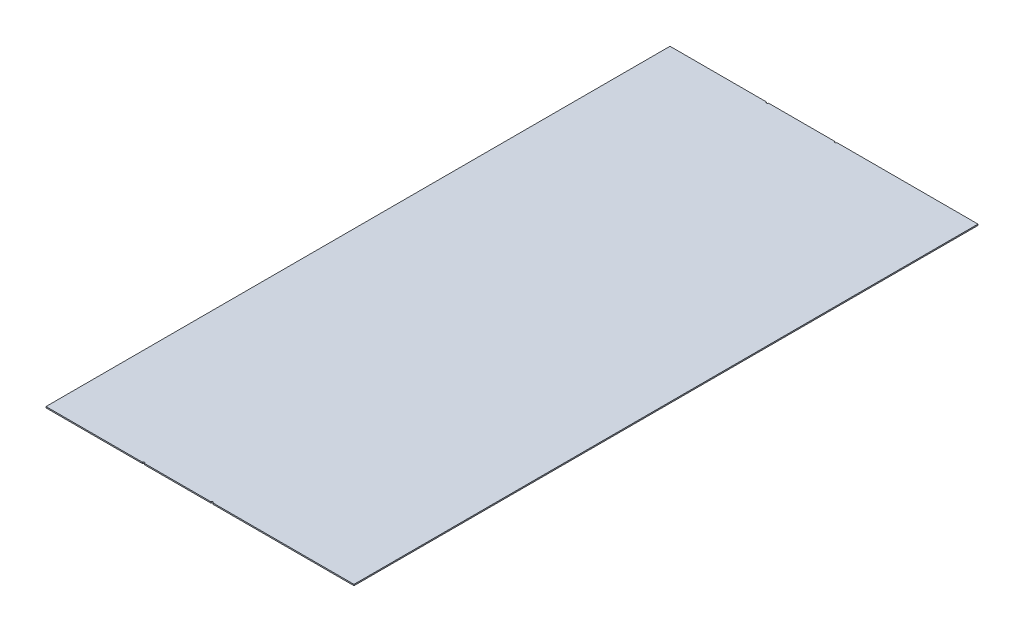
from build123d import *

# Parameters (mm, degrees)
TABAN_FLAN_1_DEPTH        = 2550
KES_EKSTR_ZYON1_OUTLINE_W = 207
KES_EKSTR_ZYON1_OUTLINE_H = 2550
KES_EKSTR_ZYON1_DEPTH     = 595
KES_EKSTR_ZYON1_START     = -5
KES_EKSTR_ZYON1_2_DEPTH   = 5
KES_EKSTR_ZYON1_3_DEPTH   = 5


# Read off the part's stored shape, not the designer's step: Kes-Ekstrüzyon1
# Sheet-metal steps are written as plain solids
with BuildPart() as part:
    # Çizim1 → Taban-Flanş1 (new body)
    with BuildSketch(Plane.XY):
        with BuildLine():
            Line((0, 0), (0, -395.857864376))
            ThreePointArc((0, -395.857864376), (0.761204675, -399.6846987), (2.928932188, -402.928932188))
            Line((2.928932188, -402.928932188), (197.071067812, -597.071067812))
            ThreePointArc((197.071067812, -597.071067812), (200.3153013, -599.238795325), (204.142135624, -600))
            Line((204.142135624, -600), (782.34, -600))
            Line((782.34, -600), (782.34, -595))
            Line((782.34, -595), (204.142135624, -595))
            ThreePointArc((204.142135624, -595), (202.228718462, -594.619397663), (200.606601718, -593.535533906))
            Line((200.606601718, -593.535533906), (6.464466094, -399.393398282))
            ThreePointArc((6.464466094, -399.393398282), (5.380602337, -397.771281538), (5, -395.857864376))
            Line((5, -395.857864376), (5, 0))
            Line((5, 0), (0, 0))
        make_face()
    extrude(amount=-TABAN_FLAN_1_DEPTH)

    # Kes-Ekstrüzyon1 outline → Kes-Ekstrüzyon1 (cut)
    with BuildSketch(Plane(origin=(0, -595, 0), x_dir=(1, 0, 0), z_dir=(0, 1, 0))):
        with Locations((103.5, 1275)):
            Rectangle(KES_EKSTR_ZYON1_OUTLINE_W, KES_EKSTR_ZYON1_OUTLINE_H)
    extrude(amount=KES_EKSTR_ZYON1_DEPTH, mode=Mode.SUBTRACT)

    # Kes-Ekstr_zyon1 2 outline → Kes-Ekstr_zyon1 2 (cut)
    with BuildSketch(Plane(origin=(0, -595, 0), x_dir=(1, 0, 0), z_dir=(0, 1, 0)).offset(KES_EKSTR_ZYON1_START)):
        with BuildLine():
            ThreePointArc((197.638678978, 2550), (201.638678978, 2546), (205.638678978, 2550))
            Line((205.638678978, 2550), (197.638678978, 2550))
        make_face()
        with BuildLine():
            Line((197.638678978, 0), (205.638678978, 0))
            ThreePointArc((205.638678978, 0), (201.638678978, 4), (197.638678978, 0))
        make_face()
    extrude(amount=KES_EKSTR_ZYON1_2_DEPTH, mode=Mode.SUBTRACT)

    # Kes-Ekstr_zyon1 3 outline → Kes-Ekstr_zyon1 3 (add)
    with BuildSketch(Plane(origin=(0, -595, 0), x_dir=(1, 0, 0), z_dir=(0, 1, 0)).offset(KES_EKSTR_ZYON1_START)):
        with BuildLine():
            ThreePointArc((-73.926675541, 2550), (-77.926675541, 2546), (-81.926675541, 2550))
            Line((-81.926675541, 2550), (-476.287996563, 2550))
            Line((-476.287996563, 2550), (-476.287996563, 0))
            Line((-476.287996563, 0), (-81.926675541, 0))
            ThreePointArc((-81.926675541, 0), (-77.926675541, 4), (-73.926675541, 0))
            Line((-73.926675541, 0), (197.638678978, 0))
            ThreePointArc((197.638678978, 0), (201.638678978, 4), (205.638678978, 0))
            Line((205.638678978, 0), (207, 0))
            Line((207, 0), (207, 2550))
            Line((207, 2550), (205.638678978, 2550))
            ThreePointArc((205.638678978, 2550), (201.638678978, 2546), (197.638678978, 2550))
            Line((197.638678978, 2550), (-73.926675541, 2550))
        make_face()
    extrude(amount=KES_EKSTR_ZYON1_3_DEPTH)


solid = part.part
